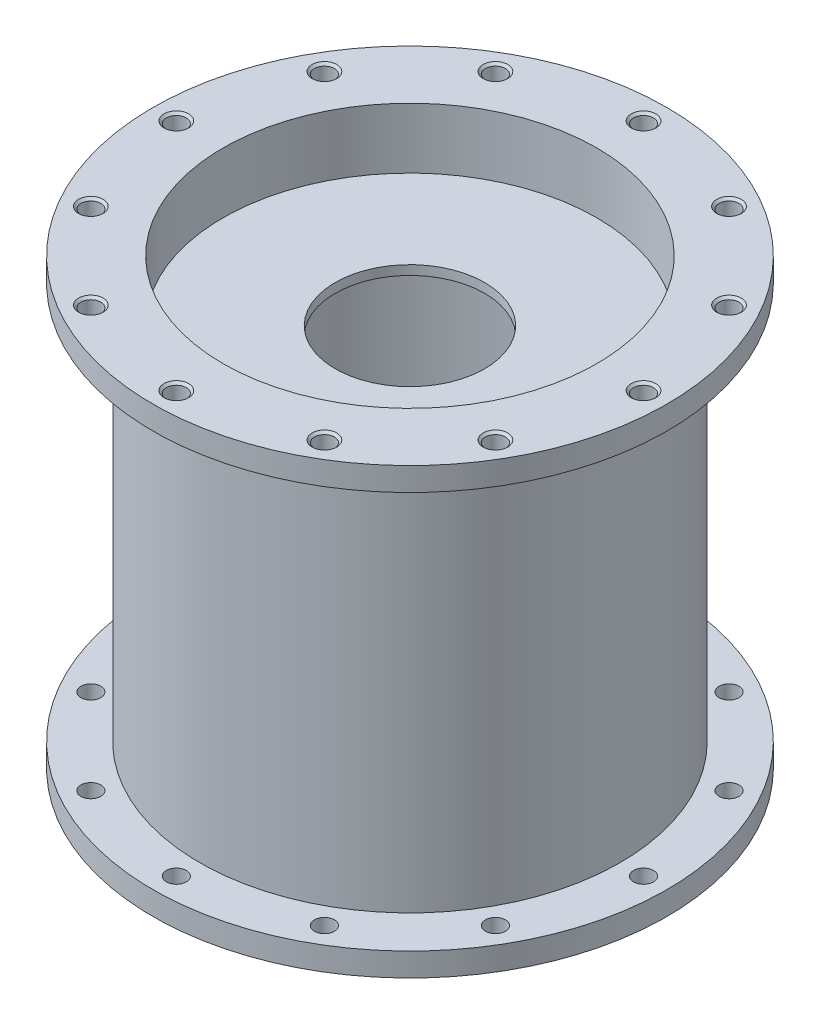
from build123d import *

# Parameters (mm, degrees)
SKETCH4_W                            = 30.48
SKETCH4_H                            = 2.54
F_3_0_213_DIAMETER_HOLE1_AT_2_COUNT  = 2
F_3_0_213_DIAMETER_HOLE1_AT_2_PITCH  = 63.5
F_3_0_213_DIAMETER_HOLE1_AT_3_COUNT  = 2
F_3_0_213_DIAMETER_HOLE1_AT_3_PITCH  = 32.870018728
F_3_0_213_DIAMETER_HOLE1_AT_4_COUNT  = 2
F_3_0_213_DIAMETER_HOLE1_AT_4_PITCH  = 63.5
F_3_0_213_DIAMETER_HOLE1_AT_5_COUNT  = 2
F_3_0_213_DIAMETER_HOLE1_AT_5_PITCH  = 89.802561211
F_3_0_213_DIAMETER_HOLE1_AT_6_COUNT  = 2
F_3_0_213_DIAMETER_HOLE1_AT_6_PITCH  = 109.985226281
F_3_0_213_DIAMETER_HOLE1_AT_7_COUNT  = 2
F_3_0_213_DIAMETER_HOLE1_AT_7_PITCH  = 122.672579939
F_3_0_213_DIAMETER_HOLE1_AT_8_COUNT  = 2
F_3_0_213_DIAMETER_HOLE1_AT_8_PITCH  = 127
F_3_0_213_DIAMETER_HOLE1_AT_9_COUNT  = 2
F_3_0_213_DIAMETER_HOLE1_AT_9_PITCH  = 122.672579939
F_3_0_213_DIAMETER_HOLE1_AT_10_COUNT = 2
F_3_0_213_DIAMETER_HOLE1_AT_10_PITCH = 109.985226281
F_3_0_213_DIAMETER_HOLE1_AT_11_COUNT = 2
F_3_0_213_DIAMETER_HOLE1_AT_11_PITCH = 89.802561211
F_3_0_213_DIAMETER_HOLE1_AT_12_COUNT = 2
F_3_0_213_DIAMETER_HOLE1_AT_12_PITCH = 63.5
F_3_0_213_DIAMETER_HOLE1_AT_13_COUNT = 2
F_3_0_213_DIAMETER_HOLE1_AT_13_PITCH = 32.870018728


with BuildPart() as part:
    # Sketch1 → Chamber (revolve)
    with BuildSketch(Plane(origin=(0, 0, 0), x_dir=(0, 0, -1), z_dir=(1, 0, 0))):
        Polygon((57.15, 6.35), (57.15, 114.3), (69.85, 114.3), (69.85, 120.65), (57.15, 120.65), (50.8, 120.65), (50.8, 114.3), (50.8, 6.35), (50.8, 0), (57.15, 0), (69.85, 0), (69.85, 6.35), align=None)
    revolve(axis=Axis((0, 0, 0), (0, 1, 0)))

    # Sketch4 → Turbulence Rings (revolve)
    with BuildSketch(Plane(origin=(0, 0, 0), x_dir=(0, 0, -1), z_dir=(1, 0, 0))):
        with Locations((35.56, 102.931657822)):
            Rectangle(SKETCH4_W, SKETCH4_H)
        with Locations((35.56, 17.718342178)):
            Rectangle(SKETCH4_W, SKETCH4_H)
    revolve(axis=Axis((0, 0, 0), (0, 1, 0)))

    # Sketch6 → #3 (0.213) Diameter Hole1 (revolve, cut)
    with BuildSketch(Plane(origin=(-54.99261314, 120.65, 31.75), x_dir=(0, 0, 1), z_dir=(1, 0, 0))):
        Polygon((0, 0), (0, 120.65), (3.3401, 120.65), (2.7051, 120.015), (2.7051, 0.635), (3.3401, 0), align=None)
    f_3_0_213_diameter_hole1 = revolve(axis=Axis((-54.99261314, 127, 31.75), (0, -1, 0)), mode=Mode.SUBTRACT)

    # #3 (0.213) Diameter Hole1 at 2: #3 (0.213) Diameter Hole1 ×2
    with Locations(*[Vector(0.8660254037844387, 0, -0.5) * (i * F_3_0_213_DIAMETER_HOLE1_AT_2_PITCH) for i in range(1, F_3_0_213_DIAMETER_HOLE1_AT_2_COUNT)]):
        add(f_3_0_213_diameter_hole1, mode=Mode.SUBTRACT)

    # #3 (0.213) Diameter Hole1 at 3: #3 (0.213) Diameter Hole1 ×2
    with Locations(*[Vector(-0.25881904510252096, 0, -0.9659258262890682) * (i * F_3_0_213_DIAMETER_HOLE1_AT_3_PITCH) for i in range(1, F_3_0_213_DIAMETER_HOLE1_AT_3_COUNT)]):
        add(f_3_0_213_diameter_hole1, mode=Mode.SUBTRACT)

    # #3 (0.213) Diameter Hole1 at 4: #3 (0.213) Diameter Hole1 ×2
    with Locations(*[(0, 0, -i * F_3_0_213_DIAMETER_HOLE1_AT_4_PITCH) for i in range(1, F_3_0_213_DIAMETER_HOLE1_AT_4_COUNT)]):
        add(f_3_0_213_diameter_hole1, mode=Mode.SUBTRACT)

    # #3 (0.213) Diameter Hole1 at 5: #3 (0.213) Diameter Hole1 ×2
    with Locations(*[Vector(0.2588190451025207, 0, -0.9659258262890683) * (i * F_3_0_213_DIAMETER_HOLE1_AT_5_PITCH) for i in range(1, F_3_0_213_DIAMETER_HOLE1_AT_5_COUNT)]):
        add(f_3_0_213_diameter_hole1, mode=Mode.SUBTRACT)

    # #3 (0.213) Diameter Hole1 at 6: #3 (0.213) Diameter Hole1 ×2
    with Locations(*[Vector(0.5, 0, -0.8660254037844387) * (i * F_3_0_213_DIAMETER_HOLE1_AT_6_PITCH) for i in range(1, F_3_0_213_DIAMETER_HOLE1_AT_6_COUNT)]):
        add(f_3_0_213_diameter_hole1, mode=Mode.SUBTRACT)

    # #3 (0.213) Diameter Hole1 at 7: #3 (0.213) Diameter Hole1 ×2
    with Locations(*[Vector(0.7071067811865475, 0, -0.7071067811865476) * (i * F_3_0_213_DIAMETER_HOLE1_AT_7_PITCH) for i in range(1, F_3_0_213_DIAMETER_HOLE1_AT_7_COUNT)]):
        add(f_3_0_213_diameter_hole1, mode=Mode.SUBTRACT)

    # #3 (0.213) Diameter Hole1 at 8: #3 (0.213) Diameter Hole1 ×2
    with Locations(*[Vector(0.8660254037844386, 0, -0.5000000000000001) * (i * F_3_0_213_DIAMETER_HOLE1_AT_8_PITCH) for i in range(1, F_3_0_213_DIAMETER_HOLE1_AT_8_COUNT)]):
        add(f_3_0_213_diameter_hole1, mode=Mode.SUBTRACT)

    # #3 (0.213) Diameter Hole1 at 9: #3 (0.213) Diameter Hole1 ×2
    with Locations(*[Vector(0.9659258262890683, 0, -0.25881904510252074) * (i * F_3_0_213_DIAMETER_HOLE1_AT_9_PITCH) for i in range(1, F_3_0_213_DIAMETER_HOLE1_AT_9_COUNT)]):
        add(f_3_0_213_diameter_hole1, mode=Mode.SUBTRACT)

    # #3 (0.213) Diameter Hole1 at 10: #3 (0.213) Diameter Hole1 ×2
    with Locations(*[(i * F_3_0_213_DIAMETER_HOLE1_AT_10_PITCH, 0, 0) for i in range(1, F_3_0_213_DIAMETER_HOLE1_AT_10_COUNT)]):
        add(f_3_0_213_diameter_hole1, mode=Mode.SUBTRACT)

    # #3 (0.213) Diameter Hole1 at 11: #3 (0.213) Diameter Hole1 ×2
    with Locations(*[Vector(0.9659258262890683, 0, 0.25881904510252074) * (i * F_3_0_213_DIAMETER_HOLE1_AT_11_PITCH) for i in range(1, F_3_0_213_DIAMETER_HOLE1_AT_11_COUNT)]):
        add(f_3_0_213_diameter_hole1, mode=Mode.SUBTRACT)

    # #3 (0.213) Diameter Hole1 at 12: #3 (0.213) Diameter Hole1 ×2
    with Locations(*[Vector(0.8660254037844386, 0, 0.5000000000000001) * (i * F_3_0_213_DIAMETER_HOLE1_AT_12_PITCH) for i in range(1, F_3_0_213_DIAMETER_HOLE1_AT_12_COUNT)]):
        add(f_3_0_213_diameter_hole1, mode=Mode.SUBTRACT)

    # #3 (0.213) Diameter Hole1 at 13: #3 (0.213) Diameter Hole1 ×2
    with Locations(*[Vector(0.7071067811865477, 0, 0.7071067811865475) * (i * F_3_0_213_DIAMETER_HOLE1_AT_13_PITCH) for i in range(1, F_3_0_213_DIAMETER_HOLE1_AT_13_COUNT)]):
        add(f_3_0_213_diameter_hole1, mode=Mode.SUBTRACT)


solid = part.part
